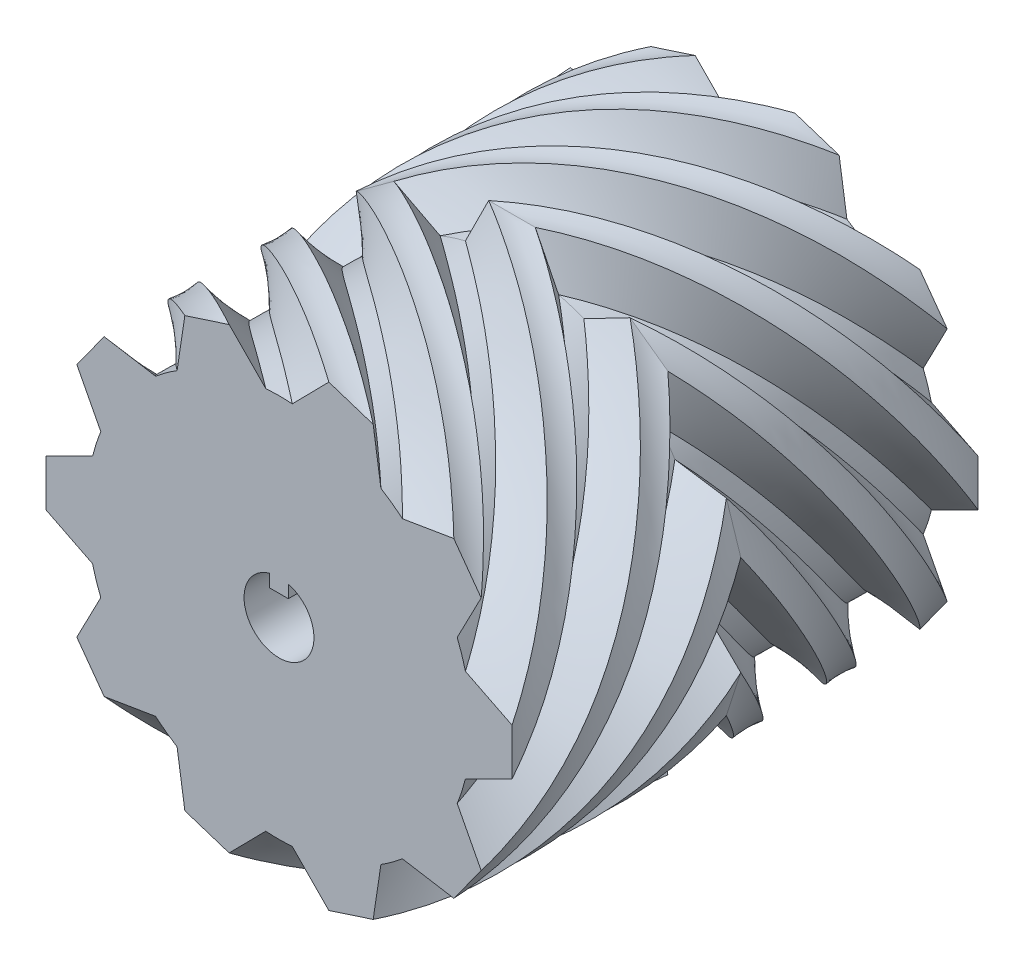
from build123d import *

# Parameters (mm, degrees)
SWEEP2_PITCH       = 20
SWEEP2_HEIGHT      = 5
SWEEP2_RADIUS      = 2.5
CUT_EXTRUDE1_DEPTH = 13.267843842


with BuildPart() as part:
    # Sweep2: sweep along a helix
    with BuildLine() as sweep2_path:
        Helix(SWEEP2_PITCH, SWEEP2_HEIGHT, SWEEP2_RADIUS, center=(0, 0, 0), direction=(0, 0, -1))
    # Sketch1 → Sweep2 (sweep)
    with BuildSketch(Plane.XY):
        with BuildLine():
            Line((-0.5, 5), (0.5, 5))
            Line((0.5, 5), (1, 4))
            ThreePointArc((1, 4), (1.274109708, 3.921306473), (1.542124015, 3.82385323))
            Line((1.542124015, 3.82385323), (2.534417764, 4.338977598))
            Line((2.534417764, 4.338977598), (3.343434759, 3.751192346))
            Line((3.343434759, 3.751192346), (3.160158004, 2.648282725))
            ThreePointArc((3.160158004, 2.648282725), (3.335662521, 2.42350068), (3.495209071, 2.187124494))
            Line((3.495209071, 2.187124494), (4.600774084, 2.02061323))
            Line((4.600774084, 2.02061323), (4.909791079, 1.069556714))
            Line((4.909791079, 1.069556714), (4.11324306, 0.285011461))
            ThreePointArc((4.11324306, 0.285011461), (4.123105626, 0), (4.11324306, -0.285011461))
            Line((4.11324306, -0.285011461), (4.909791079, -1.069556714))
            Line((4.909791079, -1.069556714), (4.600774084, -2.02061323))
            Line((4.600774084, -2.02061323), (3.495209071, -2.187124494))
            ThreePointArc((3.495209071, -2.187124494), (3.335662521, -2.42350068), (3.160158004, -2.648282725))
            Line((3.160158004, -2.648282725), (3.343434759, -3.751192346))
            Line((3.343434759, -3.751192346), (2.534417764, -4.338977598))
            Line((2.534417764, -4.338977598), (1.542124015, -3.82385323))
            ThreePointArc((1.542124015, -3.82385323), (1.274109708, -3.921306473), (1, -4))
            Line((1, -4), (0.5, -5))
            Line((0.5, -5), (-0.5, -5))
            Line((-0.5, -5), (-1, -4))
            ThreePointArc((-1, -4), (-1.274109708, -3.921306473), (-1.542124015, -3.82385323))
            Line((-1.542124015, -3.82385323), (-2.534417764, -4.338977598))
            Line((-2.534417764, -4.338977598), (-3.343434759, -3.751192346))
            Line((-3.343434759, -3.751192346), (-3.160158004, -2.648282725))
            ThreePointArc((-3.160158004, -2.648282725), (-3.335662521, -2.42350068), (-3.495209071, -2.187124494))
            Line((-3.495209071, -2.187124494), (-4.600774084, -2.02061323))
            Line((-4.600774084, -2.02061323), (-4.909791079, -1.069556714))
            Line((-4.909791079, -1.069556714), (-4.11324306, -0.285011461))
            ThreePointArc((-4.11324306, -0.285011461), (-4.123105626, 0), (-4.11324306, 0.285011461))
            Line((-4.11324306, 0.285011461), (-4.909791079, 1.069556714))
            Line((-4.909791079, 1.069556714), (-4.600774084, 2.02061323))
            Line((-4.600774084, 2.02061323), (-3.495209071, 2.187124494))
            ThreePointArc((-3.495209071, 2.187124494), (-3.335662521, 2.42350068), (-3.160158004, 2.648282725))
            Line((-3.160158004, 2.648282725), (-3.343434759, 3.751192346))
            Line((-3.343434759, 3.751192346), (-2.534417764, 4.338977598))
            Line((-2.534417764, 4.338977598), (-1.542124015, 3.82385323))
            ThreePointArc((-1.542124015, 3.82385323), (-1.274109708, 3.921306473), (-1, 4))
            Line((-1, 4), (-0.5, 5))
        make_face()
    sweep2 = sweep(path=sweep2_path.line, is_frenet=True)

    # Mirror1: Sweep2 across plane
    add(sweep2.mirror(Plane.XY))

    # Sketch4 → Cut-Extrude1 (cut, through all)
    with BuildSketch(Plane(origin=(0, 0, -5), x_dir=(-1, 0, 0), z_dir=(0, 0, -1))):
        with BuildLine():
            Line((-0.2, 0.45), (0.2, 0.45))
            Line((0.2, 0.45), (0.2, 0.722841615))
            ThreePointArc((0.2, 0.722841615), (0, -0.75), (-0.2, 0.722841615))
            Line((-0.2, 0.722841615), (-0.2, 0.45))
        make_face()
    extrude(amount=-CUT_EXTRUDE1_DEPTH, mode=Mode.SUBTRACT)


solid = part.part
